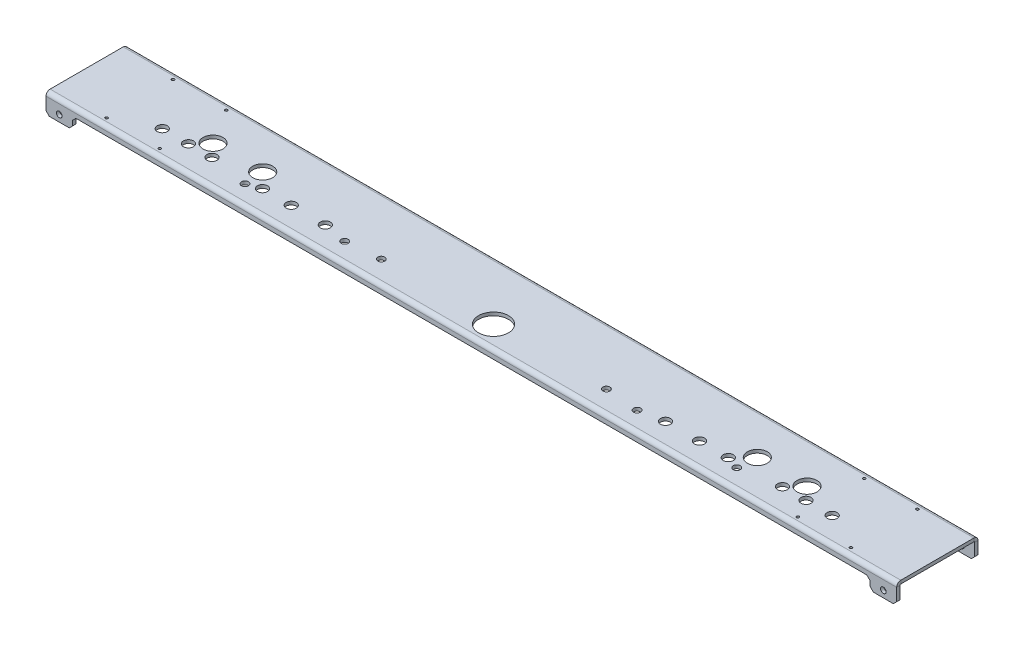
from build123d import *

# Parameters (mm, degrees)
SKETCH11_W                  = 812.8
SKETCH11_H                  = 69.85
BOSS_EXTRUDE1_DEPTH         = 3.175
HOLE1_D                     = 28.575
HOLE2_D                     = 9.652
F_2_CLEARANCE_HOLE1_D       = 2.54
F_3_4_0_75_DIAMETER_HOLE1_D = 19.05
F_1_4_CLEARANCE_HOLE1_D     = 6.7056
EDGE_FLANGE1_DEPTH          = 812.8
EDGE_FLANGE1_START          = 3.175
EDGE_FLANGE1_PROFILE_R      = 2.667
EDGE_FLANGE1_FLAT_DEPTH     = 3.175
EDGE_FLANGE2_DEPTH          = 812.8
EDGE_FLANGE2_START          = 3.175
EDGE_FLANGE2_PROFILE_R      = 2.667
EDGE_FLANGE2_FLAT_DEPTH     = 3.175


# Sheet-metal steps are written as plain solids
with BuildPart() as part:
    # Sketch11 → Boss-Extrude1 (new body)
    with BuildSketch(Plane.XZ):
        with Locations((406.4, -34.925)):
            Rectangle(SKETCH11_W, SKETCH11_H)
    extrude(amount=-BOSS_EXTRUDE1_DEPTH)

    # Hole1 (through all)
    with Locations(Plane(origin=(0, 3.175, 0), x_dir=(1, 0, 0), z_dir=(0, 1, 0))):
        with Locations((406.4, 17.272)):
            Hole(HOLE1_D / 2)

    # Hole2 (through all)
    with Locations(Plane(origin=(0, 3.175, 0), x_dir=(1, 0, 0), z_dir=(0, 1, 0))):
        with Locations((568.924874752, 19.05), (601.438495912, 19.05), (628.947697627, 19.05), (243.875125248, 19.05), (211.361504088, 19.05), (183.852302373, 19.05), (678.944202666, 20.828), (701.450372003, 20.828), (726.460886343, 20.828), (133.855797334, 20.828), (111.349627997, 20.828), (86.339113657, 20.828)):
            Hole(HOLE2_D / 2)

    # #2 Clearance Hole1 (through all)
    with Locations(Plane(origin=(0, 3.175, 0), x_dir=(1, 0, 0), z_dir=(0, 1, 0))):
        with Locations((711.2, 3.175), (711.2, 66.675), (762, 3.175), (762, 66.675), (101.6, 3.175), (50.8, 3.175), (101.6, 66.675), (50.8, 66.675)):
            Hole(F_2_CLEARANCE_HOLE1_D / 2)

    # 3/4 (0.75) Diameter Hole1 (through all)
    with Locations(Plane(origin=(0, 3.175, 0), x_dir=(1, 0, 0), z_dir=(0, 1, 0))):
        with Locations((690.197287335, 33.02), (642.712889143, 33.02), (170.087110857, 33.02), (122.602712665, 33.02)):
            Hole(F_3_4_0_75_DIAMETER_HOLE1_D / 2)

    # 1/4 Clearance Hole1 (through all)
    with Locations(Plane(origin=(0, 3.175, 0), x_dir=(1, 0, 0), z_dir=(0, 1, 0))):
        with Locations((641.35, 14.732), (546.1, 14.732), (171.45, 14.732), (266.7, 14.732), (513.925467617, 17.547282407), (298.874532383, 17.547282407)):
            Hole(F_1_4_CLEARANCE_HOLE1_D / 2)

    # Edge-Flange1 bend section (across the edge) → Edge-Flange1 (add)
    with BuildSketch(Plane(origin=(812.8, 0, 0.762), x_dir=(0, 0, -1), z_dir=(-1, 0, 0))):
        with BuildLine():
            Line((-3.175, 0.762), (0, 0.762))
            ThreePointArc((0, 0.762), (0.223184633, 0.223184633), (0.762, 0))
            Line((0.762, 0), (0.762, -3.175))
            ThreePointArc((0.762, -3.175), (-2.021879398, -2.021879398), (-3.175, 0.762))
        make_face()
    extrude(amount=EDGE_FLANGE1_DEPTH)

    # Edge-Flange1 profile (on flange) → Edge-Flange1 flat (add)
    with BuildSketch(Plane(origin=(0, 0, 0.762), x_dir=(-1, 0, 0), z_dir=(0, 0, 1)).offset(EDGE_FLANGE1_START)):
        Polygon((0, 0.762), (0, 12.7), (-3.175, 15.875), (-22.225, 15.875), (-25.4, 12.7), (-25.4, 7.9375), (-28.575, 4.7625), (-784.225, 4.7625), (-787.4, 7.9375), (-787.4, 12.7), (-790.575, 15.875), (-809.625, 15.875), (-812.8, 12.7), (-812.8, 0.762), align=None)
        with Locations((-12.7, 9.525)):
            Circle(EDGE_FLANGE1_PROFILE_R, mode=Mode.SUBTRACT)
        with Locations((-800.1, 9.525)):
            Circle(EDGE_FLANGE1_PROFILE_R, mode=Mode.SUBTRACT)
    extrude(amount=-EDGE_FLANGE1_FLAT_DEPTH)

    # Edge-Flange2 bend section (across the edge) → Edge-Flange2 (add)
    with BuildSketch(Plane(origin=(0, 0, -70.612), x_dir=(0, 0, 1), z_dir=(1, 0, 0))):
        with BuildLine():
            Line((-3.175, 0.762), (0, 0.762))
            ThreePointArc((0, 0.762), (0.223184633, 0.223184633), (0.762, 0))
            Line((0.762, 0), (0.762, -3.175))
            ThreePointArc((0.762, -3.175), (-2.021879398, -2.021879398), (-3.175, 0.762))
        make_face()
    extrude(amount=EDGE_FLANGE2_DEPTH)

    # Edge-Flange2 profile (on flange) → Edge-Flange2 flat (add)
    with BuildSketch(Plane(origin=(0, 0, -70.612), x_dir=(1, 0, 0), z_dir=(0, 0, -1)).offset(EDGE_FLANGE2_START)):
        Polygon((0, 0.762), (812.8, 0.762), (812.8, 12.7), (809.625, 15.875), (3.175, 15.875), (0, 12.7), align=None)
        with Locations((393.7, 9.525)):
            Circle(EDGE_FLANGE2_PROFILE_R, mode=Mode.SUBTRACT)
        with Locations((368.3, 9.525)):
            Circle(EDGE_FLANGE2_PROFILE_R, mode=Mode.SUBTRACT)
        with Locations((342.9, 9.525)):
            Circle(EDGE_FLANGE2_PROFILE_R, mode=Mode.SUBTRACT)
        with Locations((317.5, 9.525)):
            Circle(EDGE_FLANGE2_PROFILE_R, mode=Mode.SUBTRACT)
        with Locations((292.1, 9.525)):
            Circle(EDGE_FLANGE2_PROFILE_R, mode=Mode.SUBTRACT)
        with Locations((266.7, 9.525)):
            Circle(EDGE_FLANGE2_PROFILE_R, mode=Mode.SUBTRACT)
        with Locations((241.3, 9.525)):
            Circle(EDGE_FLANGE2_PROFILE_R, mode=Mode.SUBTRACT)
        with Locations((215.9, 9.525)):
            Circle(EDGE_FLANGE2_PROFILE_R, mode=Mode.SUBTRACT)
        with Locations((190.5, 9.525)):
            Circle(EDGE_FLANGE2_PROFILE_R, mode=Mode.SUBTRACT)
        with Locations((165.1, 9.525)):
            Circle(EDGE_FLANGE2_PROFILE_R, mode=Mode.SUBTRACT)
        with Locations((139.7, 9.525)):
            Circle(EDGE_FLANGE2_PROFILE_R, mode=Mode.SUBTRACT)
        with Locations((114.3, 9.525)):
            Circle(EDGE_FLANGE2_PROFILE_R, mode=Mode.SUBTRACT)
        with Locations((88.9, 9.525)):
            Circle(EDGE_FLANGE2_PROFILE_R, mode=Mode.SUBTRACT)
        with Locations((63.5, 9.525)):
            Circle(EDGE_FLANGE2_PROFILE_R, mode=Mode.SUBTRACT)
        with Locations((38.1, 9.525)):
            Circle(EDGE_FLANGE2_PROFILE_R, mode=Mode.SUBTRACT)
        with Locations((12.7, 9.525)):
            Circle(EDGE_FLANGE2_PROFILE_R, mode=Mode.SUBTRACT)
        with Locations((800.1, 9.525)):
            Circle(EDGE_FLANGE2_PROFILE_R, mode=Mode.SUBTRACT)
        with Locations((774.7, 9.525)):
            Circle(EDGE_FLANGE2_PROFILE_R, mode=Mode.SUBTRACT)
        with Locations((749.3, 9.525)):
            Circle(EDGE_FLANGE2_PROFILE_R, mode=Mode.SUBTRACT)
        with Locations((723.9, 9.525)):
            Circle(EDGE_FLANGE2_PROFILE_R, mode=Mode.SUBTRACT)
        with Locations((698.5, 9.525)):
            Circle(EDGE_FLANGE2_PROFILE_R, mode=Mode.SUBTRACT)
        with Locations((673.1, 9.525)):
            Circle(EDGE_FLANGE2_PROFILE_R, mode=Mode.SUBTRACT)
        with Locations((647.7, 9.525)):
            Circle(EDGE_FLANGE2_PROFILE_R, mode=Mode.SUBTRACT)
        with Locations((622.3, 9.525)):
            Circle(EDGE_FLANGE2_PROFILE_R, mode=Mode.SUBTRACT)
        with Locations((596.9, 9.525)):
            Circle(EDGE_FLANGE2_PROFILE_R, mode=Mode.SUBTRACT)
        with Locations((571.5, 9.525)):
            Circle(EDGE_FLANGE2_PROFILE_R, mode=Mode.SUBTRACT)
        with Locations((546.1, 9.525)):
            Circle(EDGE_FLANGE2_PROFILE_R, mode=Mode.SUBTRACT)
        with Locations((520.7, 9.525)):
            Circle(EDGE_FLANGE2_PROFILE_R, mode=Mode.SUBTRACT)
        with Locations((495.3, 9.525)):
            Circle(EDGE_FLANGE2_PROFILE_R, mode=Mode.SUBTRACT)
        with Locations((469.9, 9.525)):
            Circle(EDGE_FLANGE2_PROFILE_R, mode=Mode.SUBTRACT)
        with Locations((444.5, 9.525)):
            Circle(EDGE_FLANGE2_PROFILE_R, mode=Mode.SUBTRACT)
        with Locations((419.1, 9.525)):
            Circle(EDGE_FLANGE2_PROFILE_R, mode=Mode.SUBTRACT)
    extrude(amount=-EDGE_FLANGE2_FLAT_DEPTH)


solid = part.part
